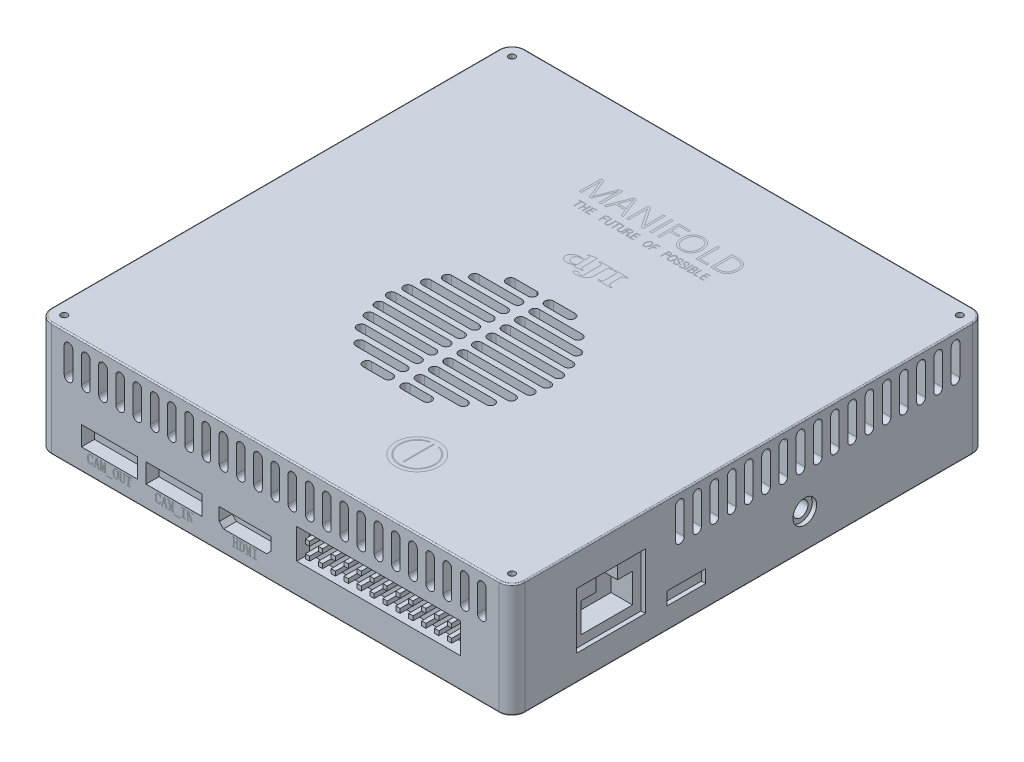
from build123d import *

# Parameters (mm, degrees)
SKETCH_1_W           = 110
SKETCH_1_H           = 110
EXTRUDE_1_DEPTH      = 26.5
FILLET_1_R           = 3
CUT_EXTRUDE_1_DEPTH  = 6
SKETCH_5_W           = 38
SKETCH_5_H           = 7
SKETCH_5_W_2         = 1
SKETCH_5_H_2         = 1
SKETCH_5_W_3         = 13
SKETCH_5_H_3         = 4.5
CUT_EXTRUDE_2_DEPTH  = 3
SKETCH_6_R           = 2.75
SKETCH_6_W           = 16
SKETCH_6_H           = 13
SKETCH_6_W_2         = 9
SKETCH_6_H_2         = 3
CUT_EXTRUDE_3_DEPTH  = 1
CUT_EXTRUDE_4_DEPTH  = 5
SKETCH_8_W           = 6
SKETCH_8_H           = 13
SKETCH_8_W_2         = 15
SKETCH_8_H_2         = 15
SKETCH_8_W_3         = 8
SKETCH_8_H_3         = 4.5
SKETCH_8_W_4         = 10.5
SKETCH_8_W_5         = 13
SKETCH_8_H_4         = 11
CUT_EXTRUDE_5_DEPTH  = 1
CUT_EXTRUDE_6_DEPTH  = 5
CUT_EXTRUDE_7_DEPTH  = 5
CUT_EXTRUDE_8_DEPTH  = 5
SKETCH_13_R          = 1.75
CUT_EXTRUDE_9_DEPTH  = 10
SKETCH_14_W          = 5.6
SKETCH_14_H          = 12.6
SKETCH_14_W_2        = 2
SKETCH_14_H_2        = 10.6
SKETCH_14_W_3        = 12.6
SKETCH_14_H_3        = 5.6
SKETCH_14_W_4        = 10.6
SKETCH_14_H_4        = 2
CUT_EXTRUDE_10_DEPTH = 10
FILLET_2_R           = 0.3
SKETCH_15_R          = 0.75
CUT_EXTRUDE_11_DEPTH = 3
CUT_EXTRUDE_START    = -3
SKETCH_16_R          = 0.75
CUT_EXTRUDE_12_DEPTH = 3
SKETCH_17_R          = 3
SKETCH_17_R_2        = 2.5
CUT_EXTRUDE_13_DEPTH = 5


with BuildPart() as part:
    # 草图1 → 凸台-拉伸1 (new body)
    with BuildSketch(Plane(origin=(0, 0, 0), x_dir=(1, 0, 0), z_dir=(0, 1, 0))):
        Rectangle(SKETCH_1_W, SKETCH_1_H)
    extrude(amount=EXTRUDE_1_DEPTH)

    # 圆角1
    fillet_1_edges = [part.edges().sort_by_distance(p)[0] for p in [
        (-55, 13.25, -55),
        (-55, 13.25, 55),
        (55, 13.25, -55),
        (55, 13.25, 55),
    ]]
    fillet(fillet_1_edges, radius=FILLET_1_R)

    # 草图4 → 切除-拉伸1 (cut)
    with BuildSketch(Plane(origin=(0, 26.5, 0), x_dir=(1, 0, 0), z_dir=(0, 1, 0))):
        with BuildLine():
            Line((2, 7.666666667), (7, 7.666666667))
            ThreePointArc((7, 7.666666667), (8, 6.666666667), (7, 5.666666667))
            Line((7, 5.666666667), (2, 5.666666667))
            ThreePointArc((2, 5.666666667), (1, 6.666666667), (2, 7.666666667))
        make_face()
        with BuildLine():
            Line((2, 4.333333333), (12, 4.333333333))
            ThreePointArc((12, 4.333333333), (13, 3.333333333), (12, 2.333333333))
            Line((12, 2.333333333), (2, 2.333333333))
            ThreePointArc((2, 2.333333333), (1, 3.333333333), (2, 4.333333333))
        make_face()
        with BuildLine():
            Line((2, 1), (15, 1))
            ThreePointArc((15, 1), (16, 0), (15, -1))
            Line((15, -1), (2, -1))
            ThreePointArc((2, -1), (1, 0), (2, 1))
        make_face()
        with BuildLine():
            Line((2, -2.333333333), (16.5, -2.333333333))
            ThreePointArc((16.5, -2.333333333), (17.5, -3.333333333), (16.5, -4.333333333))
            Line((16.5, -4.333333333), (2, -4.333333333))
            ThreePointArc((2, -4.333333333), (1, -3.333333333), (2, -2.333333333))
        make_face()
        with BuildLine():
            Line((2, -5.666666667), (17.5, -5.666666667))
            ThreePointArc((17.5, -5.666666667), (18.5, -6.666666667), (17.5, -7.666666667))
            Line((17.5, -7.666666667), (2, -7.666666667))
            ThreePointArc((2, -7.666666667), (1, -6.666666667), (2, -5.666666667))
        make_face()
        with BuildLine():
            Line((2, -9), (18, -9))
            ThreePointArc((18, -9), (19, -10), (18, -11))
            Line((18, -11), (2, -11))
            ThreePointArc((2, -11), (1, -10), (2, -9))
        make_face()
        with BuildLine():
            Line((2, -14.333333333), (17.5, -14.333333333))
            ThreePointArc((17.5, -14.333333333), (18.5, -13.333333333), (17.5, -12.333333333))
            Line((17.5, -12.333333333), (2, -12.333333333))
            ThreePointArc((2, -12.333333333), (1, -13.333333333), (2, -14.333333333))
        make_face()
        with BuildLine():
            Line((2, -17.666666667), (16.5, -17.666666667))
            ThreePointArc((16.5, -17.666666667), (17.5, -16.666666667), (16.5, -15.666666667))
            Line((16.5, -15.666666667), (2, -15.666666667))
            ThreePointArc((2, -15.666666667), (1, -16.666666667), (2, -17.666666667))
        make_face()
        with BuildLine():
            Line((2, -21), (15, -21))
            ThreePointArc((15, -21), (16, -20), (15, -19))
            Line((15, -19), (2, -19))
            ThreePointArc((2, -19), (1, -20), (2, -21))
        make_face()
        with BuildLine():
            Line((2, -24.333333333), (12, -24.333333333))
            ThreePointArc((12, -24.333333333), (13, -23.333333333), (12, -22.333333333))
            Line((12, -22.333333333), (2, -22.333333333))
            ThreePointArc((2, -22.333333333), (1, -23.333333333), (2, -24.333333333))
        make_face()
        with BuildLine():
            Line((2, -27.666666667), (7, -27.666666667))
            ThreePointArc((7, -27.666666667), (8, -26.666666667), (7, -25.666666667))
            Line((7, -25.666666667), (2, -25.666666667))
            ThreePointArc((2, -25.666666667), (1, -26.666666667), (2, -27.666666667))
        make_face()
        with BuildLine():
            Line((-2, -27.666666667), (-7, -27.666666667))
            ThreePointArc((-7, -27.666666667), (-8, -26.666666667), (-7, -25.666666667))
            Line((-7, -25.666666667), (-2, -25.666666667))
            ThreePointArc((-2, -25.666666667), (-1, -26.666666667), (-2, -27.666666667))
        make_face()
        with BuildLine():
            Line((-2, 7.666666667), (-7, 7.666666667))
            ThreePointArc((-7, 7.666666667), (-8, 6.666666667), (-7, 5.666666667))
            Line((-7, 5.666666667), (-2, 5.666666667))
            ThreePointArc((-2, 5.666666667), (-1, 6.666666667), (-2, 7.666666667))
        make_face()
        with BuildLine():
            Line((-2, 4.333333333), (-12, 4.333333333))
            ThreePointArc((-12, 4.333333333), (-13, 3.333333333), (-12, 2.333333333))
            Line((-12, 2.333333333), (-2, 2.333333333))
            ThreePointArc((-2, 2.333333333), (-1, 3.333333333), (-2, 4.333333333))
        make_face()
        with BuildLine():
            Line((-2, 1), (-15, 1))
            ThreePointArc((-15, 1), (-16, 0), (-15, -1))
            Line((-15, -1), (-2, -1))
            ThreePointArc((-2, -1), (-1, 0), (-2, 1))
        make_face()
        with BuildLine():
            Line((-2, -24.333333333), (-12, -24.333333333))
            ThreePointArc((-12, -24.333333333), (-13, -23.333333333), (-12, -22.333333333))
            Line((-12, -22.333333333), (-2, -22.333333333))
            ThreePointArc((-2, -22.333333333), (-1, -23.333333333), (-2, -24.333333333))
        make_face()
        with BuildLine():
            Line((-2, -21), (-15, -21))
            ThreePointArc((-15, -21), (-16, -20), (-15, -19))
            Line((-15, -19), (-2, -19))
            ThreePointArc((-2, -19), (-1, -20), (-2, -21))
        make_face()
        with BuildLine():
            Line((-2, -17.666666667), (-16.5, -17.666666667))
            ThreePointArc((-16.5, -17.666666667), (-17.5, -16.666666667), (-16.5, -15.666666667))
            Line((-16.5, -15.666666667), (-2, -15.666666667))
            ThreePointArc((-2, -15.666666667), (-1, -16.666666667), (-2, -17.666666667))
        make_face()
        with BuildLine():
            Line((-2, -14.333333333), (-17.5, -14.333333333))
            ThreePointArc((-17.5, -14.333333333), (-18.5, -13.333333333), (-17.5, -12.333333333))
            Line((-17.5, -12.333333333), (-2, -12.333333333))
            ThreePointArc((-2, -12.333333333), (-1, -13.333333333), (-2, -14.333333333))
        make_face()
        with BuildLine():
            Line((-2, -9), (-18, -9))
            ThreePointArc((-18, -9), (-19, -10), (-18, -11))
            Line((-18, -11), (-2, -11))
            ThreePointArc((-2, -11), (-1, -10), (-2, -9))
        make_face()
        with BuildLine():
            Line((-2, -5.666666667), (-17.5, -5.666666667))
            ThreePointArc((-17.5, -5.666666667), (-18.5, -6.666666667), (-17.5, -7.666666667))
            Line((-17.5, -7.666666667), (-2, -7.666666667))
            ThreePointArc((-2, -7.666666667), (-1, -6.666666667), (-2, -5.666666667))
        make_face()
        with BuildLine():
            Line((-2, -2.333333333), (-16.5, -2.333333333))
            ThreePointArc((-16.5, -2.333333333), (-17.5, -3.333333333), (-16.5, -4.333333333))
            Line((-16.5, -4.333333333), (-2, -4.333333333))
            ThreePointArc((-2, -4.333333333), (-1, -3.333333333), (-2, -2.333333333))
        make_face()
    extrude(amount=-CUT_EXTRUDE_1_DEPTH, mode=Mode.SUBTRACT)

    # 草图5 → 切除-拉伸2 (cut)
    # profile 1 of 4: a face of its own
    with BuildSketch(Plane.XY.offset(55)):
        with Locations((24, 10.5)):
            Rectangle(SKETCH_5_W, SKETCH_5_H)
        with Locations((10.5, 12)):
            Rectangle(SKETCH_5_W_2, SKETCH_5_H_2, mode=Mode.SUBTRACT)
        with Locations((7.5, 12)):
            Rectangle(SKETCH_5_W_2, SKETCH_5_H_2, mode=Mode.SUBTRACT)
        with Locations((13.5, 12)):
            Rectangle(SKETCH_5_W_2, SKETCH_5_H_2, mode=Mode.SUBTRACT)
        with Locations((16.5, 12)):
            Rectangle(SKETCH_5_W_2, SKETCH_5_H_2, mode=Mode.SUBTRACT)
        with Locations((19.5, 12)):
            Rectangle(SKETCH_5_W_2, SKETCH_5_H_2, mode=Mode.SUBTRACT)
        with Locations((22.5, 12)):
            Rectangle(SKETCH_5_W_2, SKETCH_5_H_2, mode=Mode.SUBTRACT)
        with Locations((25.5, 12)):
            Rectangle(SKETCH_5_W_2, SKETCH_5_H_2, mode=Mode.SUBTRACT)
        with Locations((28.5, 12)):
            Rectangle(SKETCH_5_W_2, SKETCH_5_H_2, mode=Mode.SUBTRACT)
        with Locations((31.5, 12)):
            Rectangle(SKETCH_5_W_2, SKETCH_5_H_2, mode=Mode.SUBTRACT)
        with Locations((34.5, 12)):
            Rectangle(SKETCH_5_W_2, SKETCH_5_H_2, mode=Mode.SUBTRACT)
        with Locations((37.5, 12)):
            Rectangle(SKETCH_5_W_2, SKETCH_5_H_2, mode=Mode.SUBTRACT)
        with Locations((40.5, 12)):
            Rectangle(SKETCH_5_W_2, SKETCH_5_H_2, mode=Mode.SUBTRACT)
        with Locations((10.5, 9)):
            Rectangle(SKETCH_5_W_2, SKETCH_5_H_2, mode=Mode.SUBTRACT)
        with Locations((13.5, 9)):
            Rectangle(SKETCH_5_W_2, SKETCH_5_H_2, mode=Mode.SUBTRACT)
        with Locations((16.5, 9)):
            Rectangle(SKETCH_5_W_2, SKETCH_5_H_2, mode=Mode.SUBTRACT)
        with Locations((19.5, 9)):
            Rectangle(SKETCH_5_W_2, SKETCH_5_H_2, mode=Mode.SUBTRACT)
        with Locations((22.5, 9)):
            Rectangle(SKETCH_5_W_2, SKETCH_5_H_2, mode=Mode.SUBTRACT)
        with Locations((25.5, 9)):
            Rectangle(SKETCH_5_W_2, SKETCH_5_H_2, mode=Mode.SUBTRACT)
        with Locations((28.5, 9)):
            Rectangle(SKETCH_5_W_2, SKETCH_5_H_2, mode=Mode.SUBTRACT)
        with Locations((31.5, 9)):
            Rectangle(SKETCH_5_W_2, SKETCH_5_H_2, mode=Mode.SUBTRACT)
        with Locations((34.5, 9)):
            Rectangle(SKETCH_5_W_2, SKETCH_5_H_2, mode=Mode.SUBTRACT)
        with Locations((37.5, 9)):
            Rectangle(SKETCH_5_W_2, SKETCH_5_H_2, mode=Mode.SUBTRACT)
        with Locations((40.5, 9)):
            Rectangle(SKETCH_5_W_2, SKETCH_5_H_2, mode=Mode.SUBTRACT)
        with Locations((7.5, 9)):
            Rectangle(SKETCH_5_W_2, SKETCH_5_H_2, mode=Mode.SUBTRACT)
    # profile 2 of 4: a face of its own
    with BuildSketch(Plane.XY.offset(55)):
        Polygon((-13, 9), (-1, 9), (-1, 6), (-2, 5), (-12, 5), (-13, 6), align=None)
    # profile 3 of 4: a face of its own
    with BuildSketch(Plane.XY.offset(55)):
        with Locations((-38.5, 7.25)):
            Rectangle(SKETCH_5_W_3, SKETCH_5_H_3)
    # profile 4 of 4: a face of its own
    with BuildSketch(Plane.XY.offset(55)):
        with Locations((-23.5, 7.25)):
            Rectangle(SKETCH_5_W_3, SKETCH_5_H_3)
    extrude(amount=-CUT_EXTRUDE_2_DEPTH, mode=Mode.SUBTRACT)

    # 草图6 → 切除-拉伸3 (cut)
    with BuildSketch(Plane(origin=(55, 0, 0), x_dir=(0, 0, -1), z_dir=(1, 0, 0))):
        with Locations((13, 8)):
            Circle(SKETCH_6_R)
        with Locations((-32, 12.5)):
            Rectangle(SKETCH_6_W, SKETCH_6_H)
        with Locations((-14.5, 6.5)):
            Rectangle(SKETCH_6_W_2, SKETCH_6_H_2)
    extrude(amount=-CUT_EXTRUDE_3_DEPTH, mode=Mode.SUBTRACT)

    # 草图7 → 切除-拉伸4 (cut)
    with BuildSketch(Plane(origin=(54, 0, 0), x_dir=(0, 0, -1), z_dir=(1, 0, 0))):
        Polygon((-29.5, 15), (-26, 15), (-26, 8.2), (-38, 8.2), (-38, 15), (-34.5, 15), (-34.5, 18.5), (-29.5, 18.5), align=None)
    extrude(amount=-CUT_EXTRUDE_4_DEPTH, mode=Mode.SUBTRACT)

    # 草图8 → 切除-拉伸5 (cut)
    with BuildSketch(Plane.ZY.offset(55)):
        with Locations((41, 12.5)):
            Rectangle(SKETCH_8_W, SKETCH_8_H)
        with Locations((31.5, 12.5)):
            Rectangle(SKETCH_8_W, SKETCH_8_H)
        with Locations((17.5, 13.5)):
            Rectangle(SKETCH_8_W_2, SKETCH_8_H_2)
        with Locations((-9.5, 7.25)):
            Rectangle(SKETCH_8_W_3, SKETCH_8_H_3)
        with Locations((1.25, 7.25)):
            Rectangle(SKETCH_8_W_4, SKETCH_8_H_3)
        with Locations((-37.5, 11.5)):
            Rectangle(SKETCH_8_W_5, SKETCH_8_H_4)
    extrude(amount=-CUT_EXTRUDE_5_DEPTH, mode=Mode.SUBTRACT)

    # 草图9 → 切除-拉伸6 (cut)
    with BuildSketch(Plane(origin=(55, 0, 0), x_dir=(0, 0, -1), z_dir=(1, 0, 0))):
        with BuildLine():
            Line((49, 24), (49, 17))
            ThreePointArc((49, 17), (48, 16), (47, 17))
            Line((47, 17), (47, 24))
            ThreePointArc((47, 24), (48, 25), (49, 24))
        make_face()
        with BuildLine():
            Line((45, 24), (45, 17))
            ThreePointArc((45, 17), (44, 16), (43, 17))
            Line((43, 17), (43, 24))
            ThreePointArc((43, 24), (44, 25), (45, 24))
        make_face()
        with BuildLine():
            Line((41, 24), (41, 17))
            ThreePointArc((41, 17), (40, 16), (39, 17))
            Line((39, 17), (39, 24))
            ThreePointArc((39, 24), (40, 25), (41, 24))
        make_face()
        with BuildLine():
            Line((37, 24), (37, 17))
            ThreePointArc((37, 17), (36, 16), (35, 17))
            Line((35, 17), (35, 24))
            ThreePointArc((35, 24), (36, 25), (37, 24))
        make_face()
        with BuildLine():
            Line((33, 24), (33, 17))
            ThreePointArc((33, 17), (32, 16), (31, 17))
            Line((31, 17), (31, 24))
            ThreePointArc((31, 24), (32, 25), (33, 24))
        make_face()
        with BuildLine():
            Line((29, 24), (29, 17))
            ThreePointArc((29, 17), (28, 16), (27, 17))
            Line((27, 17), (27, 24))
            ThreePointArc((27, 24), (28, 25), (29, 24))
        make_face()
        with BuildLine():
            Line((25, 24), (25, 17))
            ThreePointArc((25, 17), (24, 16), (23, 17))
            Line((23, 17), (23, 24))
            ThreePointArc((23, 24), (24, 25), (25, 24))
        make_face()
        with BuildLine():
            Line((21, 24), (21, 17))
            ThreePointArc((21, 17), (20, 16), (19, 17))
            Line((19, 17), (19, 24))
            ThreePointArc((19, 24), (20, 25), (21, 24))
        make_face()
        with BuildLine():
            Line((17, 24), (17, 17))
            ThreePointArc((17, 17), (16, 16), (15, 17))
            Line((15, 17), (15, 24))
            ThreePointArc((15, 24), (16, 25), (17, 24))
        make_face()
        with BuildLine():
            Line((13, 24), (13, 17))
            ThreePointArc((13, 17), (12, 16), (11, 17))
            Line((11, 17), (11, 24))
            ThreePointArc((11, 24), (12, 25), (13, 24))
        make_face()
        with BuildLine():
            Line((9, 24), (9, 17))
            ThreePointArc((9, 17), (8, 16), (7, 17))
            Line((7, 17), (7, 24))
            ThreePointArc((7, 24), (8, 25), (9, 24))
        make_face()
        with BuildLine():
            Line((5, 24), (5, 17))
            ThreePointArc((5, 17), (4, 16), (3, 17))
            Line((3, 17), (3, 24))
            ThreePointArc((3, 24), (4, 25), (5, 24))
        make_face()
        with BuildLine():
            Line((1, 24), (1, 17))
            ThreePointArc((1, 17), (0, 16), (-1, 17))
            Line((-1, 17), (-1, 24))
            ThreePointArc((-1, 24), (0, 25), (1, 24))
        make_face()
        with BuildLine():
            Line((-3, 24), (-3, 17))
            ThreePointArc((-3, 17), (-4, 16), (-5, 17))
            Line((-5, 17), (-5, 24))
            ThreePointArc((-5, 24), (-4, 25), (-3, 24))
        make_face()
        with BuildLine():
            Line((-7, 24), (-7, 17))
            ThreePointArc((-7, 17), (-8, 16), (-9, 17))
            Line((-9, 17), (-9, 24))
            ThreePointArc((-9, 24), (-8, 25), (-7, 24))
        make_face()
        with BuildLine():
            Line((-11, 24), (-11, 17))
            ThreePointArc((-11, 17), (-12, 16), (-13, 17))
            Line((-13, 17), (-13, 24))
            ThreePointArc((-13, 24), (-12, 25), (-11, 24))
        make_face()
        with BuildLine():
            Line((-15, 24), (-15, 17))
            ThreePointArc((-15, 17), (-16, 16), (-17, 17))
            Line((-17, 17), (-17, 24))
            ThreePointArc((-17, 24), (-16, 25), (-15, 24))
        make_face()
    extrude(amount=-CUT_EXTRUDE_6_DEPTH, mode=Mode.SUBTRACT)

    # 草图10 → 切除-拉伸7 (cut)
    with BuildSketch(Plane(origin=(0, 0, -55), x_dir=(-1, 0, 0), z_dir=(0, 0, -1))):
        with BuildLine():
            Line((-47, 24), (-47, 17))
            ThreePointArc((-47, 17), (-48, 16), (-49, 17))
            Line((-49, 17), (-49, 24))
            ThreePointArc((-49, 24), (-48, 25), (-47, 24))
        make_face()
        with BuildLine():
            Line((-43, 24), (-43, 17))
            ThreePointArc((-43, 17), (-44, 16), (-45, 17))
            Line((-45, 17), (-45, 24))
            ThreePointArc((-45, 24), (-44, 25), (-43, 24))
        make_face()
        with BuildLine():
            Line((-39, 24), (-39, 17))
            ThreePointArc((-39, 17), (-40, 16), (-41, 17))
            Line((-41, 17), (-41, 24))
            ThreePointArc((-41, 24), (-40, 25), (-39, 24))
        make_face()
        with BuildLine():
            Line((-35, 24), (-35, 17))
            ThreePointArc((-35, 17), (-36, 16), (-37, 17))
            Line((-37, 17), (-37, 24))
            ThreePointArc((-37, 24), (-36, 25), (-35, 24))
        make_face()
        with BuildLine():
            Line((-31, 24), (-31, 17))
            ThreePointArc((-31, 17), (-32, 16), (-33, 17))
            Line((-33, 17), (-33, 24))
            ThreePointArc((-33, 24), (-32, 25), (-31, 24))
        make_face()
        with BuildLine():
            Line((-27, 24), (-27, 17))
            ThreePointArc((-27, 17), (-28, 16), (-29, 17))
            Line((-29, 17), (-29, 24))
            ThreePointArc((-29, 24), (-28, 25), (-27, 24))
        make_face()
        with BuildLine():
            Line((-23, 24), (-23, 17))
            ThreePointArc((-23, 17), (-24, 16), (-25, 17))
            Line((-25, 17), (-25, 24))
            ThreePointArc((-25, 24), (-24, 25), (-23, 24))
        make_face()
        with BuildLine():
            Line((-19, 24), (-19, 17))
            ThreePointArc((-19, 17), (-20, 16), (-21, 17))
            Line((-21, 17), (-21, 24))
            ThreePointArc((-21, 24), (-20, 25), (-19, 24))
        make_face()
        with BuildLine():
            Line((-15, 24), (-15, 17))
            ThreePointArc((-15, 17), (-16, 16), (-17, 17))
            Line((-17, 17), (-17, 24))
            ThreePointArc((-17, 24), (-16, 25), (-15, 24))
        make_face()
        with BuildLine():
            Line((-11, 24), (-11, 17))
            ThreePointArc((-11, 17), (-12, 16), (-13, 17))
            Line((-13, 17), (-13, 24))
            ThreePointArc((-13, 24), (-12, 25), (-11, 24))
        make_face()
        with BuildLine():
            Line((-7, 24), (-7, 17))
            ThreePointArc((-7, 17), (-8, 16), (-9, 17))
            Line((-9, 17), (-9, 24))
            ThreePointArc((-9, 24), (-8, 25), (-7, 24))
        make_face()
        with BuildLine():
            Line((-3, 24), (-3, 17))
            ThreePointArc((-3, 17), (-4, 16), (-5, 17))
            Line((-5, 17), (-5, 24))
            ThreePointArc((-5, 24), (-4, 25), (-3, 24))
        make_face()
        with BuildLine():
            Line((1, 24), (1, 17))
            ThreePointArc((1, 17), (0, 16), (-1, 17))
            Line((-1, 17), (-1, 24))
            ThreePointArc((-1, 24), (0, 25), (1, 24))
        make_face()
        with BuildLine():
            Line((5, 24), (5, 17))
            ThreePointArc((5, 17), (4, 16), (3, 17))
            Line((3, 17), (3, 24))
            ThreePointArc((3, 24), (4, 25), (5, 24))
        make_face()
        with BuildLine():
            Line((9, 24), (9, 17))
            ThreePointArc((9, 17), (8, 16), (7, 17))
            Line((7, 17), (7, 24))
            ThreePointArc((7, 24), (8, 25), (9, 24))
        make_face()
        with BuildLine():
            Line((13, 24), (13, 17))
            ThreePointArc((13, 17), (12, 16), (11, 17))
            Line((11, 17), (11, 24))
            ThreePointArc((11, 24), (12, 25), (13, 24))
        make_face()
        with BuildLine():
            Line((17, 24), (17, 17))
            ThreePointArc((17, 17), (16, 16), (15, 17))
            Line((15, 17), (15, 24))
            ThreePointArc((15, 24), (16, 25), (17, 24))
        make_face()
        with BuildLine():
            Line((21, 24), (21, 17))
            ThreePointArc((21, 17), (20, 16), (19, 17))
            Line((19, 17), (19, 24))
            ThreePointArc((19, 24), (20, 25), (21, 24))
        make_face()
        with BuildLine():
            Line((25, 24), (25, 17))
            ThreePointArc((25, 17), (24, 16), (23, 17))
            Line((23, 17), (23, 24))
            ThreePointArc((23, 24), (24, 25), (25, 24))
        make_face()
        with BuildLine():
            Line((29, 24), (29, 17))
            ThreePointArc((29, 17), (28, 16), (27, 17))
            Line((27, 17), (27, 24))
            ThreePointArc((27, 24), (28, 25), (29, 24))
        make_face()
        with BuildLine():
            Line((33, 24), (33, 17))
            ThreePointArc((33, 17), (32, 16), (31, 17))
            Line((31, 17), (31, 24))
            ThreePointArc((31, 24), (32, 25), (33, 24))
        make_face()
        with BuildLine():
            Line((37, 24), (37, 17))
            ThreePointArc((37, 17), (36, 16), (35, 17))
            Line((35, 17), (35, 24))
            ThreePointArc((35, 24), (36, 25), (37, 24))
        make_face()
        with BuildLine():
            Line((41, 24), (41, 17))
            ThreePointArc((41, 17), (40, 16), (39, 17))
            Line((39, 17), (39, 24))
            ThreePointArc((39, 24), (40, 25), (41, 24))
        make_face()
        with BuildLine():
            Line((45, 24), (45, 17))
            ThreePointArc((45, 17), (44, 16), (43, 17))
            Line((43, 17), (43, 24))
            ThreePointArc((43, 24), (44, 25), (45, 24))
        make_face()
        with BuildLine():
            Line((49, 24), (49, 17))
            ThreePointArc((49, 17), (48, 16), (47, 17))
            Line((47, 17), (47, 24))
            ThreePointArc((47, 24), (48, 25), (49, 24))
        make_face()
    extrude(amount=-CUT_EXTRUDE_7_DEPTH, mode=Mode.SUBTRACT)

    # 草图11 → 切除-拉伸8 (cut)
    with BuildSketch(Plane.XY.offset(55)):
        with BuildLine():
            Line((-49, 17.5), (-49, 23.5))
            ThreePointArc((-49, 23.5), (-48, 24.5), (-47, 23.5))
            Line((-47, 23.5), (-47, 17.5))
            ThreePointArc((-47, 17.5), (-48, 16.5), (-49, 17.5))
        make_face()
        with BuildLine():
            Line((-45, 17.5), (-45, 23.5))
            ThreePointArc((-45, 23.5), (-44, 24.5), (-43, 23.5))
            Line((-43, 23.5), (-43, 17.5))
            ThreePointArc((-43, 17.5), (-44, 16.5), (-45, 17.5))
        make_face()
        with BuildLine():
            Line((-41, 17.5), (-41, 23.5))
            ThreePointArc((-41, 23.5), (-40, 24.5), (-39, 23.5))
            Line((-39, 23.5), (-39, 17.5))
            ThreePointArc((-39, 17.5), (-40, 16.5), (-41, 17.5))
        make_face()
        with BuildLine():
            Line((-37, 17.5), (-37, 23.5))
            ThreePointArc((-37, 23.5), (-36, 24.5), (-35, 23.5))
            Line((-35, 23.5), (-35, 17.5))
            ThreePointArc((-35, 17.5), (-36, 16.5), (-37, 17.5))
        make_face()
        with BuildLine():
            Line((-33, 17.5), (-33, 23.5))
            ThreePointArc((-33, 23.5), (-32, 24.5), (-31, 23.5))
            Line((-31, 23.5), (-31, 17.5))
            ThreePointArc((-31, 17.5), (-32, 16.5), (-33, 17.5))
        make_face()
        with BuildLine():
            Line((-29, 17.5), (-29, 23.5))
            ThreePointArc((-29, 23.5), (-28, 24.5), (-27, 23.5))
            Line((-27, 23.5), (-27, 17.5))
            ThreePointArc((-27, 17.5), (-28, 16.5), (-29, 17.5))
        make_face()
        with BuildLine():
            Line((-25, 17.5), (-25, 23.5))
            ThreePointArc((-25, 23.5), (-24, 24.5), (-23, 23.5))
            Line((-23, 23.5), (-23, 17.5))
            ThreePointArc((-23, 17.5), (-24, 16.5), (-25, 17.5))
        make_face()
        with BuildLine():
            Line((-21, 17.5), (-21, 23.5))
            ThreePointArc((-21, 23.5), (-20, 24.5), (-19, 23.5))
            Line((-19, 23.5), (-19, 17.5))
            ThreePointArc((-19, 17.5), (-20, 16.5), (-21, 17.5))
        make_face()
        with BuildLine():
            Line((-17, 17.5), (-17, 23.5))
            ThreePointArc((-17, 23.5), (-16, 24.5), (-15, 23.5))
            Line((-15, 23.5), (-15, 17.5))
            ThreePointArc((-15, 17.5), (-16, 16.5), (-17, 17.5))
        make_face()
        with BuildLine():
            Line((-13, 17.5), (-13, 23.5))
            ThreePointArc((-13, 23.5), (-12, 24.5), (-11, 23.5))
            Line((-11, 23.5), (-11, 17.5))
            ThreePointArc((-11, 17.5), (-12, 16.5), (-13, 17.5))
        make_face()
        with BuildLine():
            Line((-9, 17.5), (-9, 23.5))
            ThreePointArc((-9, 23.5), (-8, 24.5), (-7, 23.5))
            Line((-7, 23.5), (-7, 17.5))
            ThreePointArc((-7, 17.5), (-8, 16.5), (-9, 17.5))
        make_face()
        with BuildLine():
            Line((-5, 17.5), (-5, 23.5))
            ThreePointArc((-5, 23.5), (-4, 24.5), (-3, 23.5))
            Line((-3, 23.5), (-3, 17.5))
            ThreePointArc((-3, 17.5), (-4, 16.5), (-5, 17.5))
        make_face()
        with BuildLine():
            Line((-1, 17.5), (-1, 23.5))
            ThreePointArc((-1, 23.5), (0, 24.5), (1, 23.5))
            Line((1, 23.5), (1, 17.5))
            ThreePointArc((1, 17.5), (0, 16.5), (-1, 17.5))
        make_face()
        with BuildLine():
            Line((3, 17.5), (3, 23.5))
            ThreePointArc((3, 23.5), (4, 24.5), (5, 23.5))
            Line((5, 23.5), (5, 17.5))
            ThreePointArc((5, 17.5), (4, 16.5), (3, 17.5))
        make_face()
        with BuildLine():
            Line((7, 17.5), (7, 23.5))
            ThreePointArc((7, 23.5), (8, 24.5), (9, 23.5))
            Line((9, 23.5), (9, 17.5))
            ThreePointArc((9, 17.5), (8, 16.5), (7, 17.5))
        make_face()
        with BuildLine():
            Line((11, 17.5), (11, 23.5))
            ThreePointArc((11, 23.5), (12, 24.5), (13, 23.5))
            Line((13, 23.5), (13, 17.5))
            ThreePointArc((13, 17.5), (12, 16.5), (11, 17.5))
        make_face()
        with BuildLine():
            Line((15, 17.5), (15, 23.5))
            ThreePointArc((15, 23.5), (16, 24.5), (17, 23.5))
            Line((17, 23.5), (17, 17.5))
            ThreePointArc((17, 17.5), (16, 16.5), (15, 17.5))
        make_face()
        with BuildLine():
            Line((19, 17.5), (19, 23.5))
            ThreePointArc((19, 23.5), (20, 24.5), (21, 23.5))
            Line((21, 23.5), (21, 17.5))
            ThreePointArc((21, 17.5), (20, 16.5), (19, 17.5))
        make_face()
        with BuildLine():
            Line((23, 17.5), (23, 23.5))
            ThreePointArc((23, 23.5), (24, 24.5), (25, 23.5))
            Line((25, 23.5), (25, 17.5))
            ThreePointArc((25, 17.5), (24, 16.5), (23, 17.5))
        make_face()
        with BuildLine():
            Line((27, 17.5), (27, 23.5))
            ThreePointArc((27, 23.5), (28, 24.5), (29, 23.5))
            Line((29, 23.5), (29, 17.5))
            ThreePointArc((29, 17.5), (28, 16.5), (27, 17.5))
        make_face()
        with BuildLine():
            Line((31, 17.5), (31, 23.5))
            ThreePointArc((31, 23.5), (32, 24.5), (33, 23.5))
            Line((33, 23.5), (33, 17.5))
            ThreePointArc((33, 17.5), (32, 16.5), (31, 17.5))
        make_face()
        with BuildLine():
            Line((35, 17.5), (35, 23.5))
            ThreePointArc((35, 23.5), (36, 24.5), (37, 23.5))
            Line((37, 23.5), (37, 17.5))
            ThreePointArc((37, 17.5), (36, 16.5), (35, 17.5))
        make_face()
        with BuildLine():
            Line((39, 17.5), (39, 23.5))
            ThreePointArc((39, 23.5), (40, 24.5), (41, 23.5))
            Line((41, 23.5), (41, 17.5))
            ThreePointArc((41, 17.5), (40, 16.5), (39, 17.5))
        make_face()
        with BuildLine():
            Line((43, 17.5), (43, 23.5))
            ThreePointArc((43, 23.5), (44, 24.5), (45, 23.5))
            Line((45, 23.5), (45, 17.5))
            ThreePointArc((45, 17.5), (44, 16.5), (43, 17.5))
        make_face()
        with BuildLine():
            Line((47, 17.5), (47, 23.5))
            ThreePointArc((47, 23.5), (48, 24.5), (49, 23.5))
            Line((49, 23.5), (49, 17.5))
            ThreePointArc((49, 17.5), (48, 16.5), (47, 17.5))
        make_face()
    extrude(amount=-CUT_EXTRUDE_8_DEPTH, mode=Mode.SUBTRACT)

    # 草图13 → 切除-拉伸9 (cut)
    with BuildSketch(Plane(origin=(54, 0, 0), x_dir=(0, 0, -1), z_dir=(1, 0, 0))):
        with Locations((13, 8)):
            Circle(SKETCH_13_R)
    extrude(amount=-CUT_EXTRUDE_9_DEPTH, mode=Mode.SUBTRACT)

    # 草图14 → 切除-拉伸10 (cut)
    # profile 1 of 4: a face of its own
    with BuildSketch(Plane.ZY.offset(54)):
        with Locations((31.5, 12.5)):
            Rectangle(SKETCH_14_W, SKETCH_14_H)
        with Locations((32.3, 12.5)):
            Rectangle(SKETCH_14_W_2, SKETCH_14_H_2, mode=Mode.SUBTRACT)
    # profile 2 of 4: a face of its own
    with BuildSketch(Plane.ZY.offset(54)):
        with Locations((41, 12.5)):
            Rectangle(SKETCH_14_W, SKETCH_14_H)
        with Locations((41.8, 12.5)):
            Rectangle(SKETCH_14_W_2, SKETCH_14_H_2, mode=Mode.SUBTRACT)
    # profile 3 of 4: a face of its own
    with BuildSketch(Plane.ZY.offset(54)):
        with Locations((17.5, 17)):
            Rectangle(SKETCH_14_W_3, SKETCH_14_H_3)
        with Locations((17.5, 17.8)):
            Rectangle(SKETCH_14_W_4, SKETCH_14_H_4, mode=Mode.SUBTRACT)
    # profile 4 of 4: a face of its own
    with BuildSketch(Plane.ZY.offset(54)):
        with Locations((17.5, 10)):
            Rectangle(SKETCH_14_W_3, SKETCH_14_H_3)
        with Locations((17.5, 10.8)):
            Rectangle(SKETCH_14_W_4, SKETCH_14_H_4, mode=Mode.SUBTRACT)
    extrude(amount=-CUT_EXTRUDE_10_DEPTH, mode=Mode.SUBTRACT)

    # 圆角2
    fillet_2_edges = [part.edges().sort_by_distance(p)[0] for p in [
        (54.121320344, 0, 54.121320344),
        (0, 0, 55),
        (-54.121320344, 0, 54.121320344),
        (-55, 0, 0),
        (-54.121320344, 0, -54.121320344),
        (0, 0, -55),
        (54.121320344, 0, -54.121320344),
        (54.121320344, 26.5, 54.121320344),
        (0, 26.5, 55),
        (-54.121320344, 26.5, 54.121320344),
        (-55, 26.5, 0),
        (-54.121320344, 26.5, -54.121320344),
        (0, 26.5, -55),
        (54.121320344, 26.5, -54.121320344),
        (55, 0, 0),
        (55, 26.5, 0),
    ]]
    fillet(fillet_2_edges, radius=FILLET_2_R)

    # 草图15 → 切除-拉伸11 (cut)
    with BuildSketch(Plane(origin=(0, 26.5, 0), x_dir=(1, 0, 0), z_dir=(0, 1, 0))):
        with Locations((52, 52)):
            Circle(SKETCH_15_R)
        with Locations((-52, 52)):
            Circle(SKETCH_15_R)
        with Locations((-52, -52)):
            Circle(SKETCH_15_R)
        with Locations((52, -52)):
            Circle(SKETCH_15_R)
    extrude(amount=-CUT_EXTRUDE_11_DEPTH, mode=Mode.SUBTRACT)

    # 草图16 → 切除-拉伸12 (cut)
    with BuildSketch(Plane.XZ.offset(CUT_EXTRUDE_START)):
        with Locations((-52, 52)):
            Circle(SKETCH_16_R)
        with Locations((52, 52)):
            Circle(SKETCH_16_R)
        with Locations((52, -52)):
            Circle(SKETCH_16_R)
        with Locations((-52, -52)):
            Circle(SKETCH_16_R)
    extrude(amount=CUT_EXTRUDE_12_DEPTH, mode=Mode.SUBTRACT)

    # 草图17 → 切除-拉伸13 (cut)
    with BuildSketch(Plane.ZY.offset(54)):
        with Locations((-37.5, 11.5)):
            Circle(SKETCH_17_R)
        with Locations((-37.5, 11.5)):
            Circle(SKETCH_17_R_2, mode=Mode.SUBTRACT)
    extrude(amount=-CUT_EXTRUDE_13_DEPTH, mode=Mode.SUBTRACT)


solid = part.part
